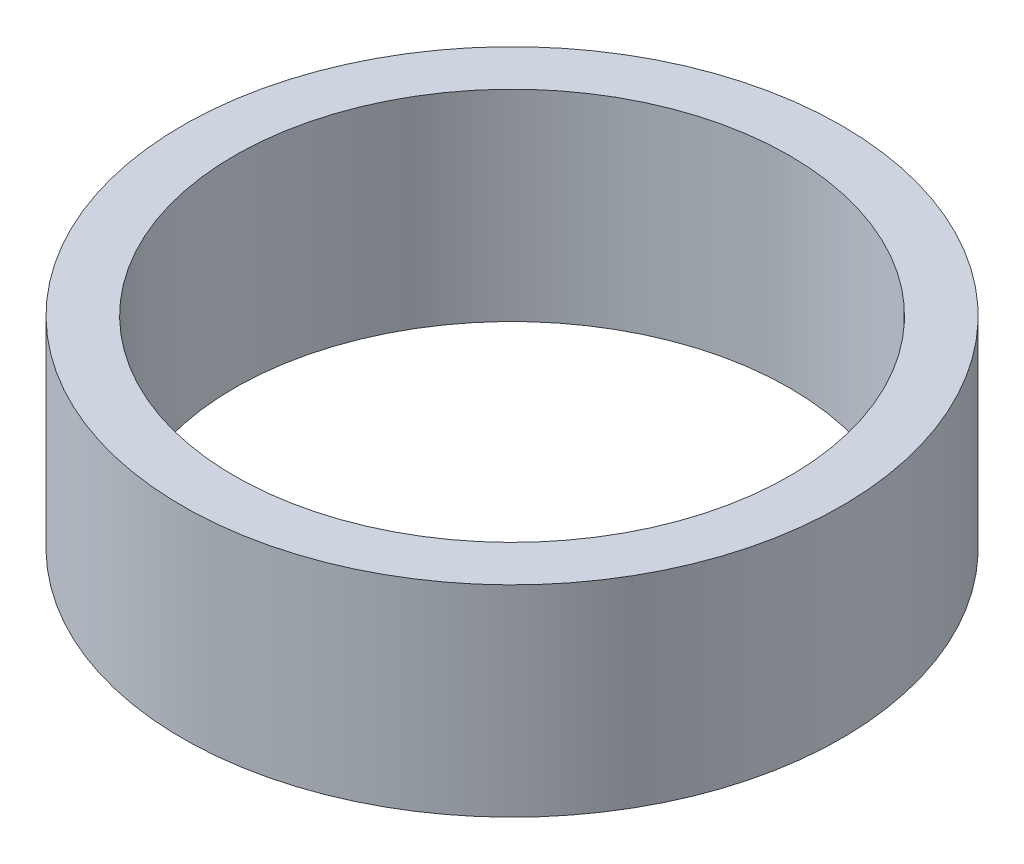
from build123d import *

# Parameters (mm, degrees)
SKETCH1_R           = 47.5
BOSS_EXTRUDE1_DEPTH = 29
SKETCH2_R           = 40
CUT_EXTRUDE1_DEPTH  = 74.167615787


with BuildPart() as part:
    # Sketch1 → Boss-Extrude1 (new body)
    with BuildSketch(Plane(origin=(0, 0, 0), x_dir=(1, 0, 0), z_dir=(0, 1, 0))):
        Circle(SKETCH1_R)
    extrude(amount=BOSS_EXTRUDE1_DEPTH)

    # Sketch2 → Cut-Extrude1 (cut, through all)
    with BuildSketch(Plane(origin=(0, 0, 0), x_dir=(1, 0, 0), z_dir=(0, 1, 0))):
        Circle(SKETCH2_R)
    extrude(amount=CUT_EXTRUDE1_DEPTH, mode=Mode.SUBTRACT)


solid = part.part
